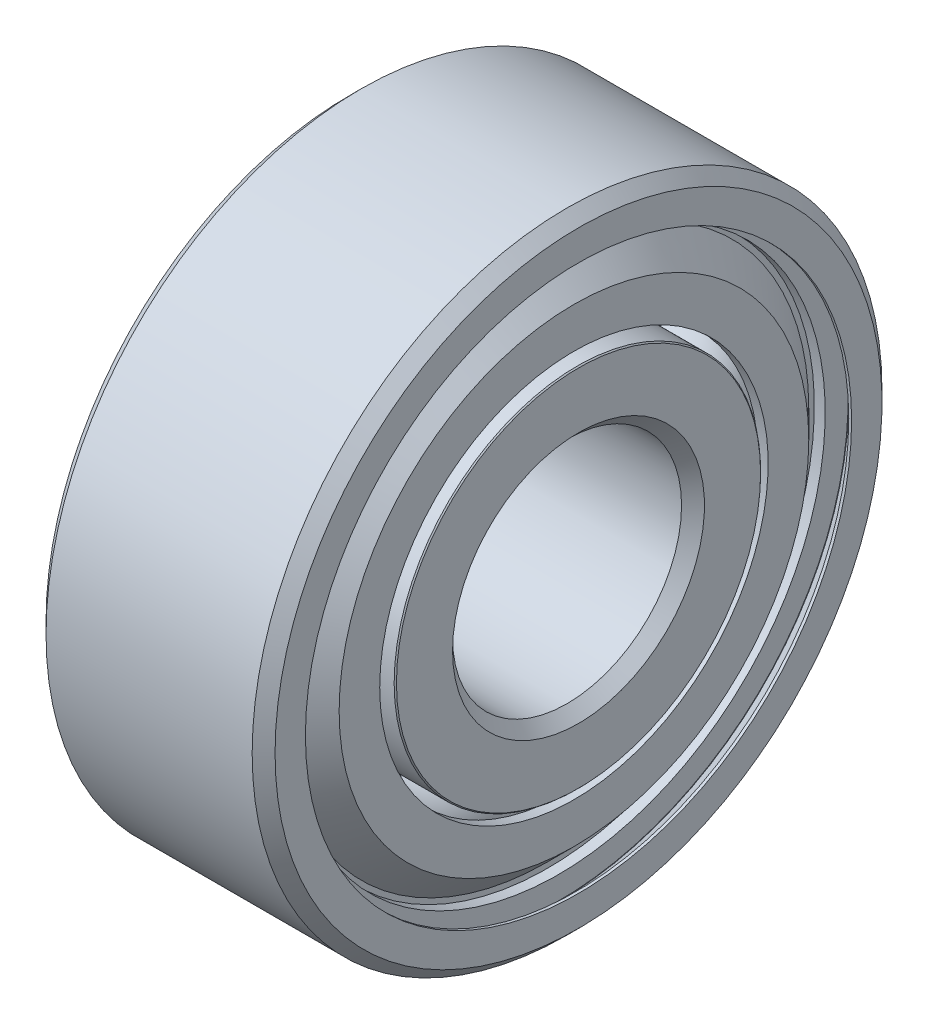
from build123d import *

# Parameters (mm, degrees)
SKETCH1_4_W       = 0.19
SKETCH1_4_H       = 0.4
CIRPATTERN2_COUNT = 8


with BuildPart() as part:
    # Sketch1 → Revolve1 (revolve)
    with BuildSketch(Plane.XY):
        with BuildLine():
            Line((-1.98, 3.2), (-2, 3.18))
            Line((-2, 3.18), (-2, 2.2))
            Line((-2, 2.2), (-1.8, 2))
            Line((-1.8, 2), (1.8, 2))
            Line((1.8, 2), (2, 2.2))
            Line((2, 2.2), (2, 3.18))
            Line((2, 3.18), (1.98, 3.2))
            Line((1.98, 3.2), (1.00871205, 3.2))
            ThreePointArc((1.00871205, 3.2), (0, 2.65), (-1.00871205, 3.2))
            Line((-1.00871205, 3.2), (-1.98, 3.2))
        make_face()
        with BuildLine():
            Line((-1.8, 5.5), (-2, 5.3))
            Line((-2, 5.3), (-2, 4.77))
            Line((-2, 4.77), (-1.95, 4.77))
            Line((-1.95, 4.77), (-1.65, 5.07))
            Line((-1.65, 5.07), (-1.45, 5.07))
            Line((-1.45, 5.07), (-1.45, 4.77))
            Line((-1.45, 4.77), (-1.25, 4.77))
            Line((-1.25, 4.77), (-1.25, 4.5))
            Line((-1.25, 4.5), (-1.00871205, 4.5))
            ThreePointArc((-1.00871205, 4.5), (0, 5.05), (1.00871205, 4.5))
            Line((1.00871205, 4.5), (1.25, 4.5))
            Line((1.25, 4.5), (1.25, 4.77))
            Line((1.25, 4.77), (1.45, 4.77))
            Line((1.45, 4.77), (1.45, 5.07))
            Line((1.45, 5.07), (1.65, 5.07))
            Line((1.65, 5.07), (1.95, 4.77))
            Line((1.95, 4.77), (2, 4.77))
            Line((2, 4.77), (2, 5.3))
            Line((2, 5.3), (1.8, 5.5))
            Line((1.8, 5.5), (-1.8, 5.5))
        make_face()
    revolve(axis=Axis((0, 0, 0), (1, 0, 0)))


with BuildPart() as body_2:
    # Sketch1<3> → Revolve2 (revolve)
    with BuildSketch(Plane.XY):
        Polygon((-1.267044482, 4.756515811), (-1.447044482, 4.756515811), (-1.447044482, 4.574558441), (-1.92036514, 4.101237783), (-1.92036514, 3.392543849), (-1.74036514, 3.392543849), (-1.74036514, 4.026679342), (-1.267044482, 4.5), align=None)
        Polygon((1.447044482, 4.756515811), (1.267044482, 4.756515811), (1.267044482, 4.5), (1.74036514, 4.026679342), (1.74036514, 3.392543849), (1.92036514, 3.392543849), (1.92036514, 4.101237783), (1.447044482, 4.574558441), align=None)
    revolve(axis=Axis((0, 0, 0), (1, 0, 0)))


with BuildPart() as body_3:
    # Sketch1<4> → Revolve3 (revolve)
    with BuildSketch(Plane.XY):
        with Locations((-1.553908134, 4.860421419)):
            Rectangle(SKETCH1_4_W, SKETCH1_4_H)
        with Locations((1.553908134, 4.860421419)):
            Rectangle(SKETCH1_4_W, SKETCH1_4_H)
    revolve(axis=Axis((0, 0, 0), (1, 0, 0)))


with BuildPart() as body_4:
    # Sketch1<5> → Revolve4 (revolve)
    with BuildSketch(Plane.XY):
        with BuildLine():
            ThreePointArc((1.15, 3.85), (0.813172798, 4.663172798), (0, 5))
            Line((0, 5), (0, 2.7))
            ThreePointArc((0, 2.7), (0.813172798, 3.036827202), (1.15, 3.85))
        make_face()
    revolve(axis=Axis((0, 5, 0), (0, -1, 0)))


with BuildPart() as cirpattern2_1:
    # CirPattern2: pattern copy
    add(body_4.part.rotate(Axis((0, 0, 0), (-1, 0, 0)), 1 * 360 / CIRPATTERN2_COUNT))


with BuildPart() as cirpattern2_2:
    # CirPattern2: pattern copy
    add(body_4.part.rotate(Axis((0, 0, 0), (-1, 0, 0)), 2 * 360 / CIRPATTERN2_COUNT))


with BuildPart() as cirpattern2_3:
    # CirPattern2: pattern copy
    add(body_4.part.rotate(Axis((0, 0, 0), (-1, 0, 0)), 3 * 360 / CIRPATTERN2_COUNT))


with BuildPart() as cirpattern2_4:
    # CirPattern2: pattern copy
    add(body_4.part.rotate(Axis((0, 0, 0), (-1, 0, 0)), 4 * 360 / CIRPATTERN2_COUNT))


with BuildPart() as cirpattern2_5:
    # CirPattern2: pattern copy
    add(body_4.part.rotate(Axis((0, 0, 0), (-1, 0, 0)), 5 * 360 / CIRPATTERN2_COUNT))


with BuildPart() as cirpattern2_6:
    # CirPattern2: pattern copy
    add(body_4.part.rotate(Axis((0, 0, 0), (-1, 0, 0)), 6 * 360 / CIRPATTERN2_COUNT))


with BuildPart() as cirpattern2_7:
    # CirPattern2: pattern copy
    add(body_4.part.rotate(Axis((0, 0, 0), (-1, 0, 0)), 7 * 360 / CIRPATTERN2_COUNT))


solid = Compound([part.part, body_2.part, body_3.part, body_4.part, cirpattern2_1.part, cirpattern2_2.part, cirpattern2_3.part, cirpattern2_4.part, cirpattern2_5.part, cirpattern2_6.part, cirpattern2_7.part])
